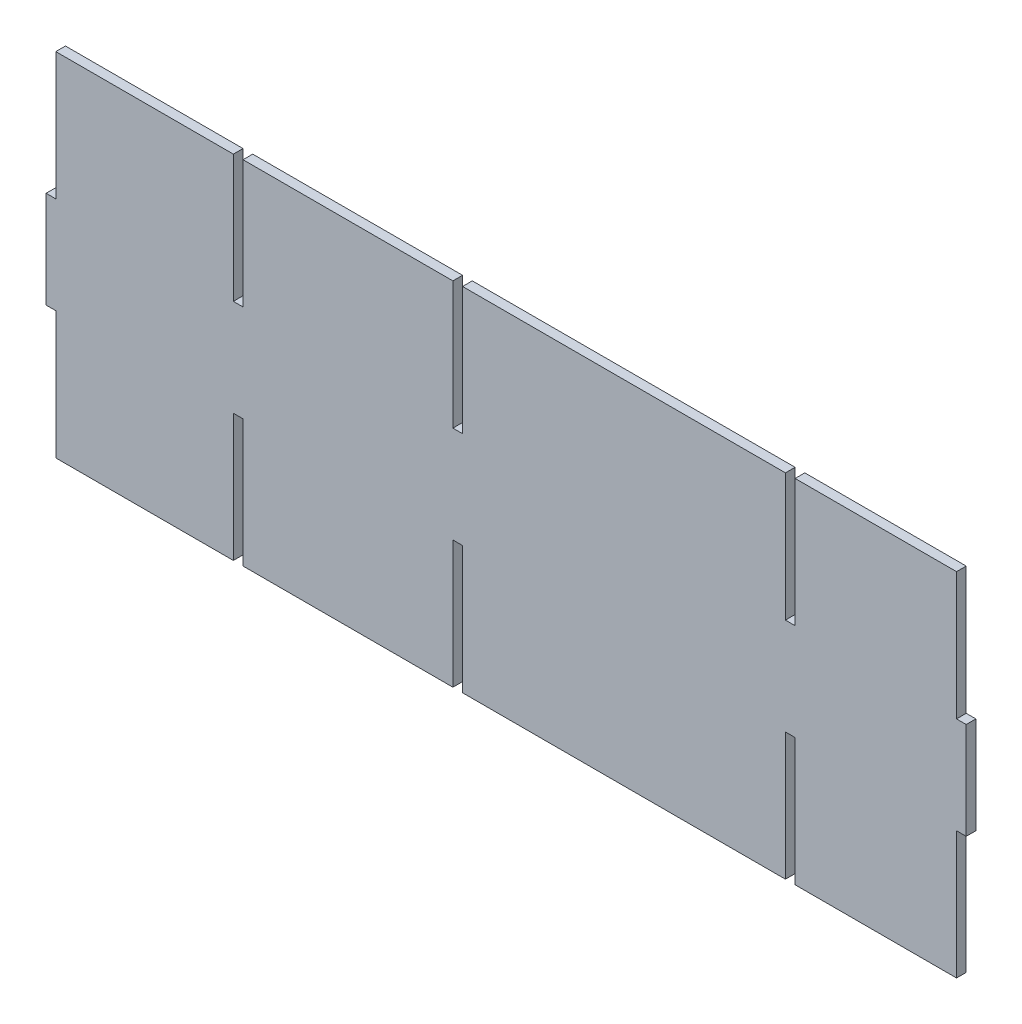
from build123d import *

# Parameters (mm, degrees)
BOSS_EXTRUDE1_DEPTH = 3


with BuildPart() as part:
    # Sketch1 → Boss-Extrude1 (new body)
    with BuildSketch(Plane.XY):
        Polygon((0, 0), (3, 0), (3, -39.5), (58, -39.5), (58, 0), (61, 0), (61, -39.5), (126, -39.5), (126, 0), (129, 0), (129, -39.5), (229, -39.5), (229, 0), (232, 0), (232, -39.5), (282, -39.5), (282, 0), (285, 0), (285, 30), (282, 30), (282, 69.5), (232, 69.5), (232, 30), (229, 30), (229, 69.5), (129, 69.5), (129, 30), (126, 30), (126, 69.5), (61, 69.5), (61, 30), (58, 30), (58, 69.5), (3, 69.5), (3, 30), (0, 30), align=None)
    extrude(amount=BOSS_EXTRUDE1_DEPTH)


solid = part.part
